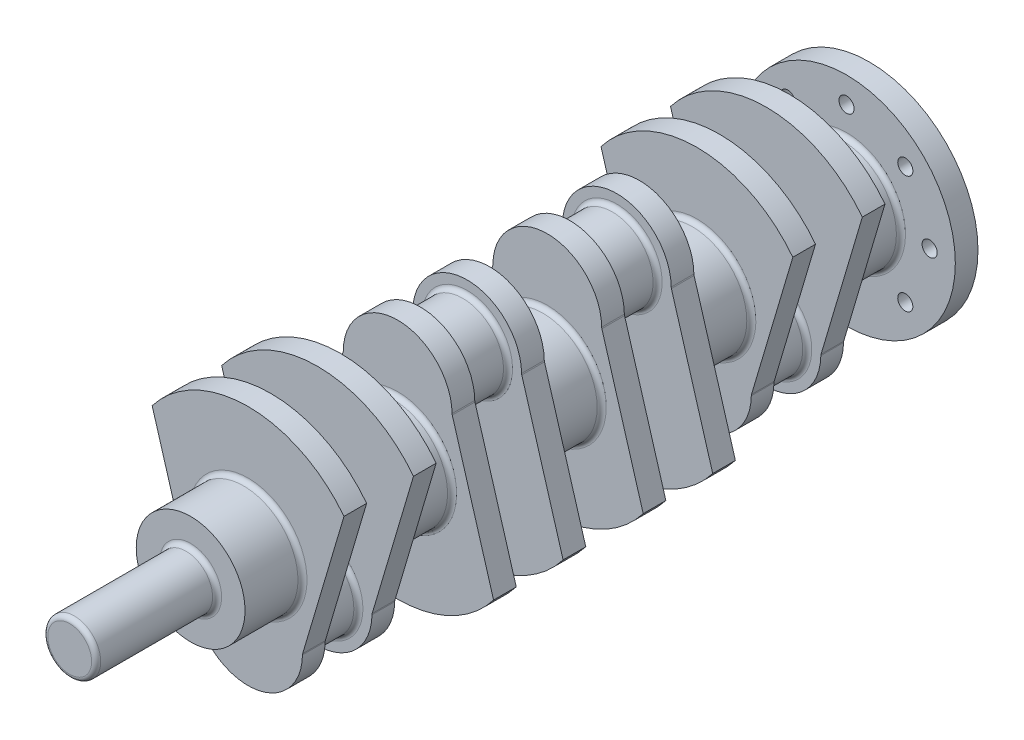
from build123d import *

# Parameters (mm, degrees)
SKETCH1_R             = 27
BOSS_EXTRUDE1_DEPTH   = 15
SKETCH1_3_R           = 27
BOSS_EXTRUDE2_DEPTH   = 46
SKETCH3_R             = 36
BOSS_EXTRUDE3_DEPTH   = 38
MIRROR2_START         = 46
MIRROR2_DEPTH         = 15
BODY_MOVE_COPY1_ANGLE = 180
SKETCH4_R             = 17.5
BOSS_EXTRUDE4_DEPTH   = 80
SKETCH5_R             = 72
SKETCH5_R_2           = 17.703587944
SKETCH5_R_3           = 5
BOSS_EXTRUDE5_DEPTH   = 15
FILLET1_R             = 3


# Read off the part's stored shape, not the designer's step: Mirror2
with BuildPart() as part:
    # Sketch1 → Boss-Extrude1 (new body)
    with BuildSketch(Plane.XY):
        with BuildLine():
            ThreePointArc((63.461769721, 48.709380861), (0, 80), (-63.461769721, 48.709380861))
            Line((-63.461769721, 48.709380861), (-36, -44))
            ThreePointArc((-36, -44), (0, -80), (36, -44))
            Line((36, -44), (63.461769721, 48.709380861))
        make_face()
        with Locations((0, -44)):
            Circle(SKETCH1_R, mode=Mode.SUBTRACT)
    extrude(amount=BOSS_EXTRUDE1_DEPTH)

    # Sketch1<3> → Boss-Extrude2 (add)
    with BuildSketch(Plane.XY):
        with Locations((0, -44)):
            Circle(SKETCH1_3_R)
    extrude(amount=BOSS_EXTRUDE2_DEPTH)

    # Sketch3 → Boss-Extrude3 (add)
    with BuildSketch(Plane(origin=(0, 0, 0), x_dir=(-1, 0, 0), z_dir=(0, 0, -1))):
        Circle(SKETCH3_R)
    boss_extrude3 = extrude(amount=BOSS_EXTRUDE3_DEPTH)

    # Mirror2 outline → Mirror2 (add)
    with BuildSketch(Plane.XY.offset(MIRROR2_START)):
        with BuildLine():
            Line((36, -44), (63.461769721, 48.709380861))
            ThreePointArc((63.461769721, 48.709380861), (0, 80), (-63.461769721, 48.709380861))
            Line((-63.461769721, 48.709380861), (-36, -44))
            ThreePointArc((-36, -44), (0, -80), (36, -44))
        make_face()
    extrude(amount=MIRROR2_DEPTH)

    # Mirror3: Boss-Extrude3 across plane
    add(boss_extrude3.mirror(Plane.XY.offset(30.5)))


with BuildPart() as body_2:
    # Mirror4: mirrored copy
    add(part.part.mirror(Plane(origin=(0, 0, -19), x_dir=(1, 0, 0), z_dir=(0, 0, -1))))


with BuildPart() as body_2_1:
    # Body-Move/Copy1: moved
    add(body_2.part.rotate(Axis((0, 0, -68.5), (1, 0, 0)), BODY_MOVE_COPY1_ANGLE))


with BuildPart() as body_3:
    # Mirror5: mirrored copy
    add(part.part.mirror(Plane(origin=(0, 0, -118), x_dir=(1, 0, 0), z_dir=(0, 0, -1))))

    # Sketch5 → Boss-Extrude5 (add)
    with BuildSketch(Plane(origin=(0, 0, -335), x_dir=(-1, 0, 0), z_dir=(0, 0, -1))):
        with Locations(Location((0, 0, 0), (0, 0, 90))):
            Circle(SKETCH5_R)
        with Locations(Location((0, 0, 0), (0, 0, 90))):
            Circle(SKETCH5_R_2, mode=Mode.SUBTRACT)
        with Locations(Location((0, 55, 0), (0, 0, 90))):
            Circle(SKETCH5_R_3, mode=Mode.SUBTRACT)
        with Locations(Location((38.890872965, 38.890872965, 0), (0, 0, 90))):
            Circle(SKETCH5_R_3, mode=Mode.SUBTRACT)
        with Locations(Location((55, 0, 0), (0, 0, 90))):
            Circle(SKETCH5_R_3, mode=Mode.SUBTRACT)
        with Locations(Location((38.890872965, -38.890872965, 0), (0, 0, 90))):
            Circle(SKETCH5_R_3, mode=Mode.SUBTRACT)
        with Locations(Location((0, -55, 0), (0, 0, 90))):
            Circle(SKETCH5_R_3, mode=Mode.SUBTRACT)
        with Locations(Location((-38.890872965, -38.890872965, 0), (0, 0, 90))):
            Circle(SKETCH5_R_3, mode=Mode.SUBTRACT)
        with Locations(Location((-55, 0, 0), (0, 0, 90))):
            Circle(SKETCH5_R_3, mode=Mode.SUBTRACT)
        with Locations(Location((-38.890872965, 38.890872965, 0), (0, 0, 90))):
            Circle(SKETCH5_R_3, mode=Mode.SUBTRACT)
    extrude(amount=BOSS_EXTRUDE5_DEPTH)


with BuildPart() as body_4:
    # Mirror5 2: mirrored copy
    add(body_2_1.part.mirror(Plane(origin=(0, 0, -118), x_dir=(1, 0, 0), z_dir=(0, 0, -1))))


with BuildPart() as part_1:
    add(part.part)

    # Sketch4 → Boss-Extrude4 (add)
    with BuildSketch(Plane.XY.offset(99)):
        Circle(SKETCH4_R)
    extrude(amount=BOSS_EXTRUDE4_DEPTH)


with BuildPart() as body_3_1:
    add(body_3.part)

    # Combine1: union body 4, part, body 2
    add(body_4.part)
    add(part_1.part)
    add(body_2_1.part)

    # Fillet1
    fillet1_edges = [body_3_1.edges().sort_by_distance(p)[0] for p in [
        (-27, -44, 15),
        (36, 0, 0),
        (36, 0, 61),
        (-36, -44, 53.5),
        (36, -44, 53.5),
        (-27, -44, 46),
        (-17.5, 0, 99),
        (-17.5, 0, 179),
        (-36, 44, -91.5),
        (36, 44, -91.5),
        (-27, 44, -84),
        (36, 0, -99),
        (-27, 44, -53),
        (36, 0, -38),
        (-36, 44, -45.5),
        (36, 44, -45.5),
        (36, -44, -243.5),
        (-36, -44, -243.5),
        (-27, -44, -282),
        (36, 0, -236),
        (-27, -44, -251),
        (-36, -44, -289.5),
        (36, -44, -289.5),
        (36, 0, -335),
        (36, 0, -297),
        (0, -17.703587944, -335),
        (-36, 44, -144.5),
        (36, 44, -144.5),
        (-27, 44, -152),
        (36, 0, -137),
        (36, 0, -198),
        (-36, 44, -190.5),
        (36, 44, -190.5),
        (-27, 44, -183),
        (-36, -44, 7.5),
        (36, -44, 7.5),
    ]]
    fillet(fillet1_edges, radius=FILLET1_R)


solid = body_3_1.part
